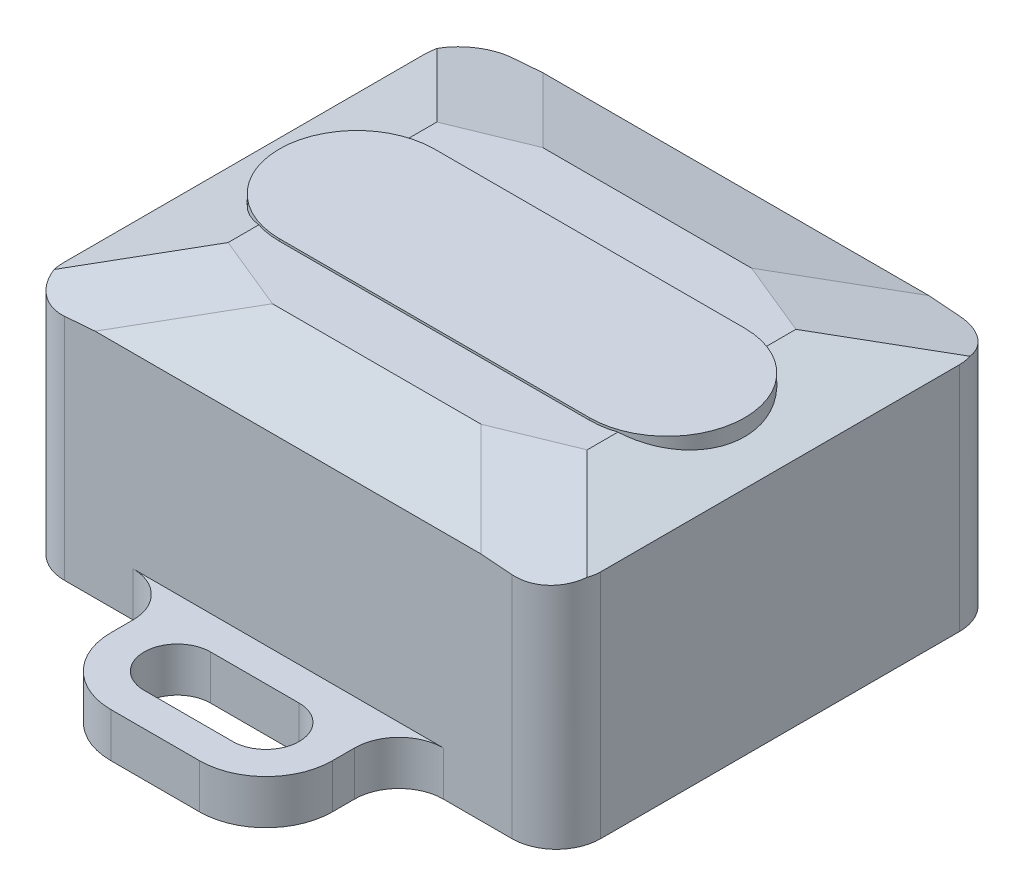
from build123d import *
from OCP.BRepFilletAPI import BRepFilletAPI_MakeChamfer

# Parameters (mm, degrees)
SKETCH_1_W       = 24.2
SKETCH_1_H       = 20.2
EXTRUDE_1_DEPTH  = 11.5
EXTRUDE_2_DEPTH  = 2
FILLET_1_R       = 2
EXTRUDE_3_DEPTH  = 0.1
CHAMFER_1_SIZE   = 4
CHAMFER_1_SIZE_2 = 1.07179677
CHAMFER_3_SIZE   = 1
CHAMFER_3_SIZE2  = 2.43937374
FILLET_2_R       = 2


with BuildPart() as part:
    # 草图1 → 凸台-拉伸1 (new body)
    with BuildSketch(Plane(origin=(0, 0, 0), x_dir=(1, 0, 0), z_dir=(0, 1, 0))):
        with Locations((12.1, 10.1)):
            Rectangle(SKETCH_1_W, SKETCH_1_H)
    extrude(amount=EXTRUDE_1_DEPTH)

    # 草图2 → 凸台-拉伸2 (add)
    # profile 1 of 2: a face of its own
    with BuildSketch(Plane.XZ):
        with BuildLine():
            Line((17.1, 0), (7.1, 0))
            Line((7.1, 0), (7.1, 3))
            ThreePointArc((7.1, 3), (7.978679656, 5.121320344), (10.1, 6))
            Line((10.1, 6), (14.1, 6))
            ThreePointArc((14.1, 6), (16.221320344, 5.121320344), (17.1, 3))
            Line((17.1, 3), (17.1, 0))
        make_face()
        with BuildLine():
            Line((14.1, 1.5), (10.1, 1.5))
            ThreePointArc((10.1, 1.5), (8.6, 3), (10.1, 4.5))
            Line((10.1, 4.5), (14.1, 4.5))
            ThreePointArc((14.1, 4.5), (15.6, 3), (14.1, 1.5))
        make_face(mode=Mode.SUBTRACT)
    # profile 2 of 2: a face of its own
    with BuildSketch(Plane.XZ):
        with BuildLine():
            Line((7.1, -23.2), (7.1, -20.2))
            Line((7.1, -20.2), (17.1, -20.2))
            Line((17.1, -20.2), (17.1, -23.2))
            ThreePointArc((17.1, -23.2), (16.221320344, -25.321320344), (14.1, -26.2))
            Line((14.1, -26.2), (10.1, -26.2))
            ThreePointArc((10.1, -26.2), (7.978679656, -25.321320344), (7.1, -23.2))
        make_face()
        with BuildLine():
            Line((14.1, -21.7), (10.1, -21.7))
            ThreePointArc((10.1, -21.7), (8.6, -23.2), (10.1, -24.7))
            Line((10.1, -24.7), (14.1, -24.7))
            ThreePointArc((14.1, -24.7), (15.6, -23.2), (14.1, -21.7))
        make_face(mode=Mode.SUBTRACT)
    extrude(amount=-EXTRUDE_2_DEPTH)

    # 圆角1
    fillet_1_edges = [part.edges().sort_by_distance(p)[0] for p in [
        (7.1, 1, -20.2),
        (17.1, 1, -20.2),
        (17.1, 1, 0),
        (7.1, 1, 0),
    ]]
    fillet(fillet_1_edges, radius=FILLET_1_R)

    # 草图3 → 凸台-拉伸3 (add)
    with BuildSketch(Plane(origin=(0, 11.5, 0), x_dir=(1, 0, 0), z_dir=(0, 1, 0))):
        with BuildLine():
            Line((5.1, 13.6), (19.1, 13.6))
            ThreePointArc((19.1, 13.6), (22.6, 10.1), (19.1, 6.6))
            Line((19.1, 6.6), (5.1, 6.6))
            ThreePointArc((5.1, 6.6), (1.6, 10.1), (5.1, 13.6))
        make_face()
    extrude(amount=EXTRUDE_3_DEPTH)

    # 倒角1
    # the kernel refuses this chamfer: 4, 1.07179677 mm, written as the material it takes off along each edge
    with BuildSketch(Plane(origin=(24.2, 11.5, 10.386886281), x_dir=(-1, 0, 0), z_dir=(0, 0, -1))) as chamfer_1_piece_1_section:
        Polygon((CHAMFER_1_SIZE, 0), (0, -CHAMFER_1_SIZE_2), (0, 0), align=None)
    chamfer_1_piece_1 = extrude(amount=40.973772562, mode=Mode.PRIVATE)
    chamfer_1_piece_1 = chamfer_1_piece_1 - Plane(origin=(19.1, 11.5, -10.1), x_dir=(0, 0, -1), z_dir=(0, -1, 0)) * Cylinder(3.5, 98, mode=Mode.PRIVATE)
    add(chamfer_1_piece_1, mode=Mode.SUBTRACT)
    with BuildSketch(Plane(origin=(34.586886281, 11.5, -20.2), x_dir=(0, 0, 1), z_dir=(-1, 0, 0))) as chamfer_1_piece_2:
        Polygon((CHAMFER_1_SIZE, 0), (0, -CHAMFER_1_SIZE_2), (0, 0), align=None)
    extrude(amount=44.973772562, mode=Mode.SUBTRACT)
    with BuildSketch(Plane(origin=(0, 11.5, -30.586886281), x_dir=(0, -1, 0), z_dir=(0, 0, 1))) as chamfer_1_piece_3_section:
        Polygon((CHAMFER_1_SIZE_2, 0), (0, CHAMFER_1_SIZE), (0, 0), align=None)
    chamfer_1_piece_3 = extrude(amount=40.973772562, mode=Mode.PRIVATE)
    chamfer_1_piece_3 = chamfer_1_piece_3 - Plane(origin=(5.1, 11.5, -10.1), x_dir=(0, 0, 1), z_dir=(0, -1, 0)) * Cylinder(3.5, 98, mode=Mode.PRIVATE)
    add(chamfer_1_piece_3, mode=Mode.SUBTRACT)
    with BuildSketch(Plane(origin=(-10.386886281, 11.5, 0), x_dir=(0, -1, 0), z_dir=(1, 0, 0))) as chamfer_1_piece_4:
        Polygon((CHAMFER_1_SIZE_2, 0), (0, CHAMFER_1_SIZE), (0, 0), align=None)
    extrude(amount=44.973772562, mode=Mode.SUBTRACT)

    # 倒角3: one chamfer whose edges measure the first distance from different faces: ONE call of the kernel's chamfer builder (chamfer() names one face for all edges)
    chamfer_3_edges_1 = [part.edges().sort_by_distance(p)[0] for p in [
        (22.2, 10.964101615, -2),
        (22.2, 10.964101615, -18.2),
    ]]
    chamfer_3_side_1 = [part.faces().sort_by_distance(p)[0] for p in [
        (22.621463638, 10.851170773, -10.1),
    ]]
    chamfer_3_edges_2 = [part.edges().sort_by_distance(p)[0] for p in [
        (2, 10.964101615, -2),
        (2, 10.964101615, -18.2),
    ]]
    chamfer_3_side_2 = [part.faces().sort_by_distance(p)[0] for p in [
        (1.578536362, 10.851170773, -10.1),
    ]]
    chamfer_3 = BRepFilletAPI_MakeChamfer(part.part.solid().wrapped)
    for e in chamfer_3_edges_1:
        chamfer_3.Add(CHAMFER_3_SIZE, CHAMFER_3_SIZE2, e.wrapped, chamfer_3_side_1[0].wrapped)  # the first distance lies on this face
    for e in chamfer_3_edges_2:
        chamfer_3.Add(CHAMFER_3_SIZE, CHAMFER_3_SIZE2, e.wrapped, chamfer_3_side_2[0].wrapped)  # the first distance lies on this face
    add(Compound.cast(chamfer_3.Shape()), mode=Mode.REPLACE)

    # 圆角2
    fillet_2_edges = [part.edges().sort_by_distance(p)[0] for p in [
        (0, 5.081990675, 0),
        (0, 5.081990675, -20.2),
        (24.2, 5.081990675, -20.2),
        (24.2, 5.081990675, 0),
    ]]
    fillet(fillet_2_edges, radius=FILLET_2_R)


solid = part.part
